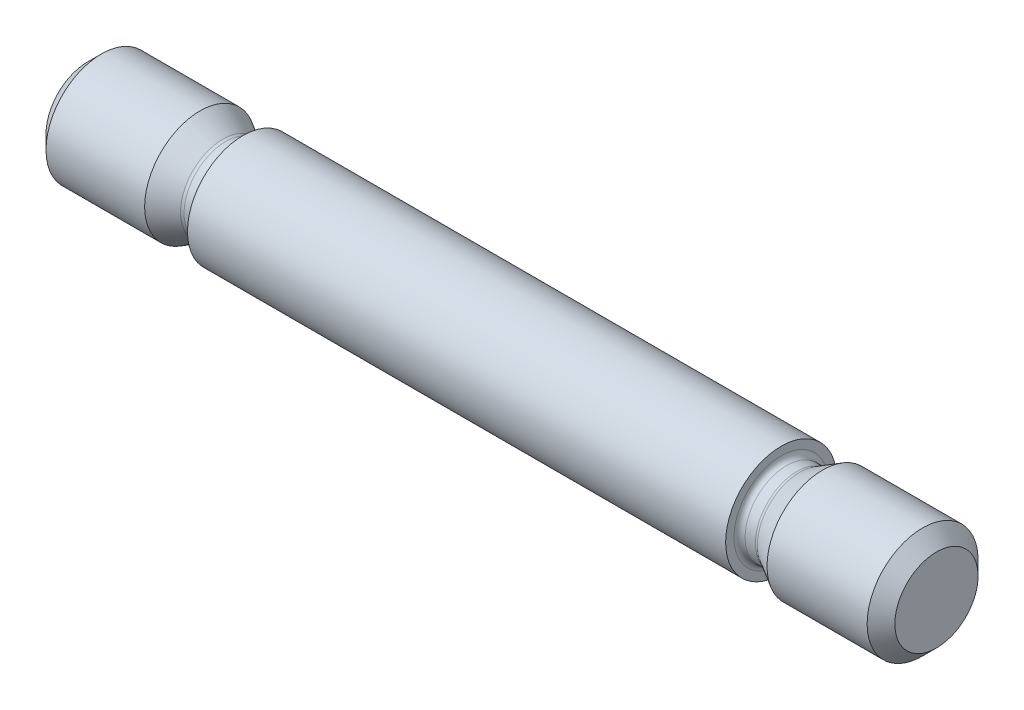
from build123d import *


with BuildPart() as part:
    # BodySke → BaseBody (revolve)
    with BuildSketch(Plane.XY):
        with BuildLine():
            Line((19.5, 6.107179677), (16.221539031, 8))
            Line((16.221539031, 8), (2, 8))
            Line((2, 8), (0, 6))
            Line((0, 6), (0, 0))
            Line((0, 0), (122.4, 0))
            Line((122.4, 0), (122.4, 6))
            Line((122.4, 6), (120.4, 8))
            Line((120.4, 8), (105.964101615, 8))
            Line((105.964101615, 8), (102.685640646, 6.107179677))
            ThreePointArc((102.685640646, 6.107179677), (102.492695882, 6.027259339), (102.285640646, 6))
            Line((102.285640646, 6), (100.8, 6))
            ThreePointArc((100.8, 6), (100.234314575, 6.234314575), (100, 6.8))
            Line((100, 6.8), (100, 8))
            Line((100, 8), (22.4, 8))
            Line((22.4, 8), (22.4, 6.8))
            ThreePointArc((22.4, 6.8), (22.165685425, 6.234314575), (21.6, 6))
            Line((21.6, 6), (19.9, 6))
            ThreePointArc((19.9, 6), (19.692944764, 6.027259339), (19.5, 6.107179677))
        make_face()
    revolve(axis=Axis((-3.175, 0, 0), (1, 0, 0)))


solid = part.part
